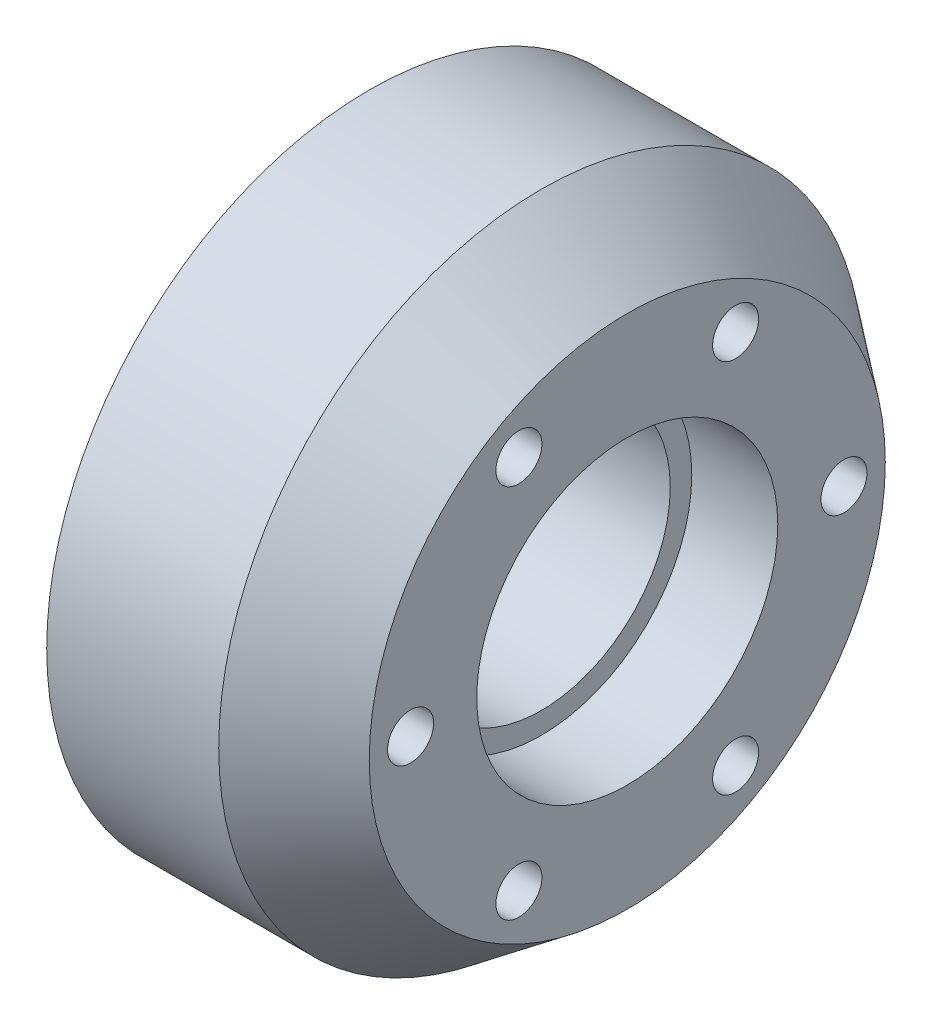
from build123d import *

# Parameters (mm, degrees)
CIRPATTERN1_COUNT = 6


with BuildPart() as part:
    # Sketch1 → Revolve1 (revolve)
    with BuildSketch(Plane.XY):
        Polygon((0, 23.8125), (0, 9.525), (12.7, 9.525), (12.7, 11.1125), (19.05, 11.1125), (19.05, 19.05), (12.7, 23.8125), align=None)
    revolve(axis=Axis((0, 0, 0), (-1, 0, 0)))

    # Sketch2 → Cut-Revolve1 (revolve, cut)
    with BuildSketch(Plane(origin=(0, 0, 0), x_dir=(1, 0, 0), z_dir=(0, 1, 0))):
        Polygon((19.05, 16), (0, 16), (0, 19.25), (12.7, 19.25), (12.7, 17.7), (19.05, 17.7), align=None)
    cut_revolve1 = revolve(axis=Axis((19.05, 0, -16), (1, 0, 0)), mode=Mode.SUBTRACT)

    # Sketch3 → Cut-Revolve2 (revolve, cut)
    with BuildSketch(Plane.XY):
        Polygon((0, 19.05), (11.666564541, 19.05), (9.525, 22.225), (0, 22.225), align=None)
    cut_revolve2 = revolve(axis=Axis((0, 19.05, 0), (-1, 0, 0)), mode=Mode.SUBTRACT)

    # CirPattern1: Cut-Revolve1, Cut-Revolve2 ×6 about axis
    cirpattern1_axis = Axis((0, 0, 0), (1, 0, 0))
    add([cut_revolve1.rotate(cirpattern1_axis, i * 360 / CIRPATTERN1_COUNT) for i in range(1, CIRPATTERN1_COUNT)], mode=Mode.SUBTRACT)
    add([cut_revolve2.rotate(cirpattern1_axis, i * 360 / CIRPATTERN1_COUNT) for i in range(1, CIRPATTERN1_COUNT)], mode=Mode.SUBTRACT)


solid = part.part
